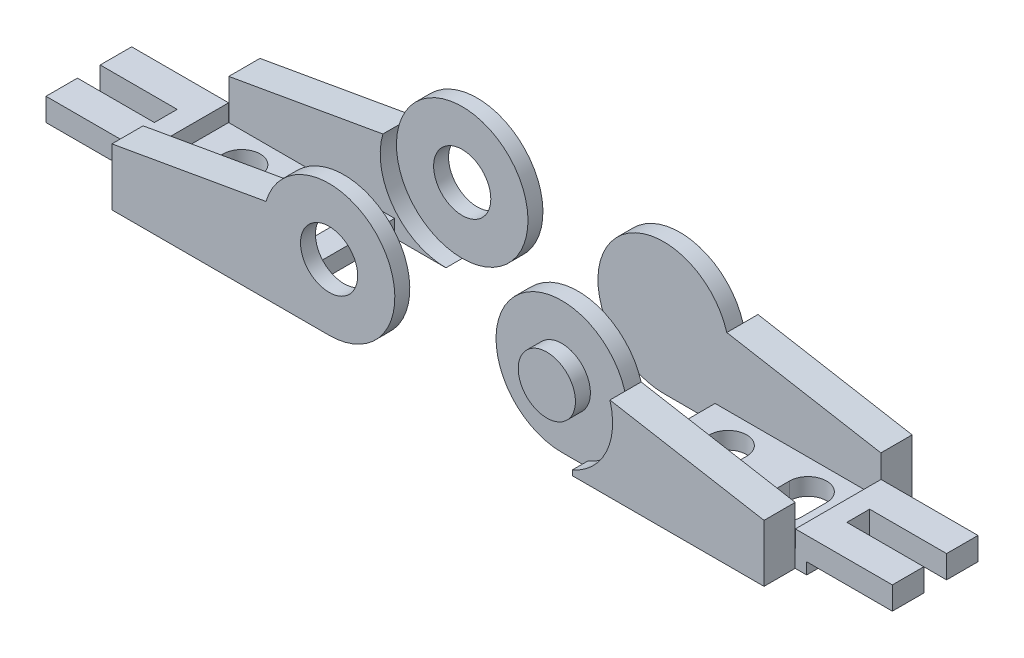
from build123d import *

# Parameters (mm, degrees)
EXTRUDE1_DEPTH             = 12.954
SKETCH3_R                  = 5.0038
CUT_EXTRUDE1_DEPTH         = 2.6162
CUT_EXTRUDE2_DEPTH         = 7.493
EXTRUDE2_REACH             = 43.762
EXTRUDE2_DIRECTION_2_REACH = 43.762
SKETCH7_W                  = 13.462
SKETCH7_H                  = 3.9878
CUT_EXTRUDE3_DEPTH         = 60.003631422
CUT_EXTRUDE4_DEPTH         = 60.936836987
EXTRUDE3_OUTLINE_R         = 5.0038
EXTRUDE3_DEPTH             = 2.6162
EXTRUDE4_DEPTH             = 2.6162
SKETCH9_R                  = 5.0038
CUT_EXTRUDE5_DEPTH         = 98.311619982
CUT_EXTRUDE6_START         = -10.3378
SKETCH12_R                 = 11.5062
CUT_EXTRUDE6_DEPTH         = 20.6756


# Read off the part's stored shape, not the designer's step: Extrude3
with BuildPart() as part:
    # Sketch2 → Extrude1 (new, symmetric)
    with BuildSketch(Plane.XY):
        with BuildLine():
            Line((37.9984, -11.5062), (37.9984, -1.4986))
            Line((37.9984, -1.4986), (11.036020087, 3.255595043))
            ThreePointArc((11.036020087, 3.255595043), (-9.215534877, 6.889597621), (0, -11.5062))
            Line((0, -11.5062), (37.9984, -11.5062))
        make_face()
    extrude(amount=EXTRUDE1_DEPTH, both=True)

    # Sketch3 → Cut-Extrude1 (cut)
    with BuildSketch(Plane.XY.offset(12.954)):
        with BuildLine():
            Line((0, -11.5062), (4.495154191, -11.5062))
            Line((4.495154191, -11.5062), (4.495154191, -10.5918))
            ThreePointArc((4.495154191, -10.5918), (-2.293607342, 11.27528287), (0, -11.5062))
        make_face()
        Circle(SKETCH3_R, mode=Mode.SUBTRACT)
    cut_extrude1 = extrude(amount=-CUT_EXTRUDE1_DEPTH, mode=Mode.SUBTRACT)

    # Mirror1: Cut-Extrude1 across plane
    add(cut_extrude1.mirror(Plane.XY), mode=Mode.SUBTRACT)

    # Sketch4 → Cut-Extrude2 (cut, symmetric)
    with BuildSketch(Plane.XY):
        with BuildLine():
            Line((8.9916, -8.509), (37.9984, -8.509))
            Line((37.9984, -8.509), (37.9984, -1.4986))
            Line((37.9984, -1.4986), (11.036020087, 3.255595043))
            ThreePointArc((11.036020087, 3.255595043), (-9.215534877, 6.889597621), (0, -11.5062))
            Line((0, -11.5062), (8.9916, -11.5062))
            Line((8.9916, -11.5062), (8.9916, -8.509))
        make_face()
    extrude(amount=CUT_EXTRUDE2_DEPTH, both=True, mode=Mode.SUBTRACT)

    # Extrude2: up to this face of the body (flat: up to its plane)
    extrude2_end = Plane(part.part.faces().sort_by_distance((8.815484891, -1.610467544, -7.493))[0])
    # Sketch5 → Extrude2 (add, up to the picked face)
    with BuildSketch(Plane.XY, mode=Mode.PRIVATE) as extrude2_sk1:
        Polygon((54.991, -5.5118), (38.0238, -5.5118), (38.0238, -8.509), (37.9984, -8.509), (37.9984, -11.5062), (40.005, -11.5062), (40.005, -9.4996), (54.991, -9.4996), align=None)
    extrude2_tool1 = split(extrude(extrude2_sk1.sketch, amount=-EXTRUDE2_REACH, mode=Mode.PRIVATE), bisect_by=extrude2_end, keep=Keep.BOTH, mode=Mode.PRIVATE)
    add(extrude2_tool1.solids().sort_by(Axis((46.083002, -7.674508, 0), (0, 0, -1)))[0])

    # Extrude2 direction 2: up to this face of the body (flat: up to its plane)
    extrude2_direction_2_end = Plane(part.part.faces().sort_by_distance((8.815484891, -1.610467544, 7.493))[0])
    # Sketch5 → Extrude2 direction 2 (add, up to the picked face)
    with BuildSketch(Plane.XY, mode=Mode.PRIVATE) as extrude2_direction_2_sk1:
        Polygon((54.991, -5.5118), (38.0238, -5.5118), (38.0238, -8.509), (37.9984, -8.509), (37.9984, -11.5062), (40.005, -11.5062), (40.005, -9.4996), (54.991, -9.4996), align=None)
    extrude2_direction_2_tool1 = split(extrude(extrude2_direction_2_sk1.sketch, amount=EXTRUDE2_DIRECTION_2_REACH, mode=Mode.PRIVATE), bisect_by=extrude2_direction_2_end, keep=Keep.BOTH, mode=Mode.PRIVATE)
    add(extrude2_direction_2_tool1.solids().sort_by(Axis((46.083002, -7.674508, 0), (0, 0, 1)))[0])

    # Sketch7 → Cut-Extrude3 (cut, through all)
    with BuildSketch(Plane(origin=(0, -5.5118, 0), x_dir=(1, 0, 0), z_dir=(0, 1, 0))):
        with Locations((48.26, 0)):
            Rectangle(SKETCH7_W, SKETCH7_H)
    extrude(amount=-CUT_EXTRUDE3_DEPTH, mode=Mode.SUBTRACT)

    # Sketch8 → Cut-Extrude4 (cut, through all)
    with BuildSketch(Plane(origin=(0, -8.509, 0), x_dir=(1, 0, 0), z_dir=(0, 1, 0))):
        with BuildLine():
            Line((19.7612, 2.2479), (19.7612, -2.2479))
            ThreePointArc((19.7612, -2.2479), (16.51, -5.4991), (13.2588, -2.2479))
            Line((13.2588, -2.2479), (13.2588, 2.2479))
            ThreePointArc((13.2588, 2.2479), (16.51, 5.4991), (19.7612, 2.2479))
        make_face()
        with BuildLine():
            Line((33.7566, 2.2479), (33.7566, -2.2479))
            ThreePointArc((33.7566, -2.2479), (30.5054, -5.4991), (27.2542, -2.2479))
            Line((27.2542, -2.2479), (27.2542, 2.2479))
            ThreePointArc((27.2542, 2.2479), (30.5054, 5.4991), (33.7566, 2.2479))
        make_face()
    extrude(amount=-CUT_EXTRUDE4_DEPTH, mode=Mode.SUBTRACT)


with BuildPart() as body_2:
    # Mirror3: mirrored copy
    add(part.part.mirror(Plane(origin=(-19.05, 0, 0), x_dir=(0, 0, 1), z_dir=(1, 0, 0))))

    # Extrude3 outline → Extrude3 (add)
    with BuildSketch(Plane.XY.offset(10.3378)):
        with BuildLine():
            ThreePointArc((-38.1, -11.5062), (-28.884465123, 6.889597621), (-49.136020087, 3.255595043))
            ThreePointArc((-49.136020087, 3.255595043), (-48.503938244, -4.91433693), (-42.595154191, -10.5918))
            Line((-42.595154191, -10.5918), (-42.595154191, -11.5062))
            Line((-42.595154191, -11.5062), (-38.1, -11.5062))
        make_face()
        with Locations((-38.1, 0)):
            Circle(EXTRUDE3_OUTLINE_R, mode=Mode.SUBTRACT)
    extrude(amount=EXTRUDE3_DEPTH)

    # Sketch11 → Extrude4 (add)
    with BuildSketch(Plane(origin=(0, 0, -10.3378), x_dir=(-1, 0, 0), z_dir=(0, 0, -1))):
        with BuildLine():
            Line((38.1, -11.5062), (42.595154191, -11.5062))
            Line((42.595154191, -11.5062), (42.595154191, -10.5918))
            ThreePointArc((42.595154191, -10.5918), (48.503938244, -4.91433693), (49.136020087, 3.255595043))
            ThreePointArc((49.136020087, 3.255595043), (28.884465123, 6.889597621), (38.1, -11.5062))
        make_face()
    extrude(amount=EXTRUDE4_DEPTH)

    # Sketch9 → Cut-Extrude5 (cut, through all)
    with BuildSketch(Plane.XY.offset(12.954)):
        with Locations((-38.1, 0)):
            Circle(SKETCH9_R)
    extrude(amount=-CUT_EXTRUDE5_DEPTH, mode=Mode.SUBTRACT)

    # Sketch12 → Cut-Extrude6 (cut)
    with BuildSketch(Plane.XY.offset(CUT_EXTRUDE6_START)):
        with Locations((-38.1, 0)):
            Circle(SKETCH12_R)
    extrude(amount=CUT_EXTRUDE6_DEPTH, mode=Mode.SUBTRACT)


solid = Compound([part.part, body_2.part])
